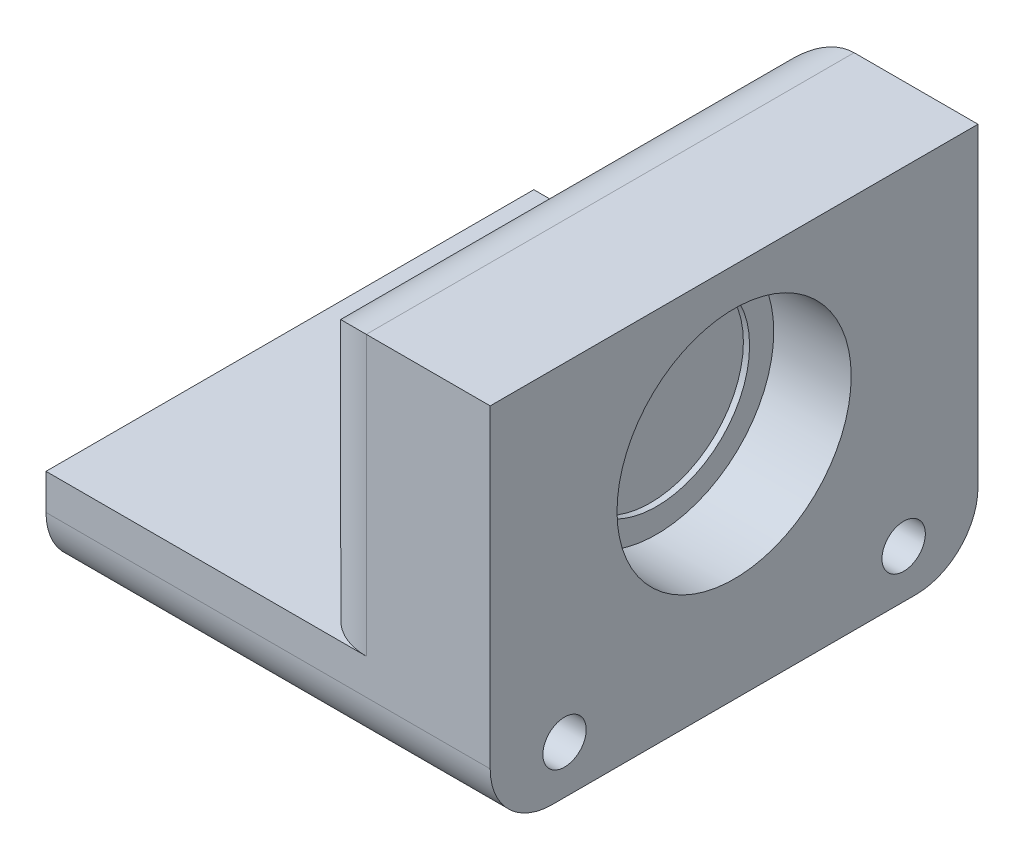
from build123d import *

# Parameters (mm, degrees)
BOSS_EXTRUDE1_DEPTH                            = 20
SKETCH2_R                                      = 1.27
CUT_EXTRUDE1_DEPTH                             = 4.000000128
SKETCH3_R                                      = 4.8006
CUT_EXTRUDE2_DEPTH                             = 3.175
SKETCH4_R                                      = 3.81
CUT_EXTRUDE3_DEPTH                             = 0.254
CUT_EXTRUDE4_START                             = -3.175
SKETCH5_R                                      = 4.8006
CUT_EXTRUDE4_DEPTH                             = 3.175
CUT_EXTRUDE5_START                             = -0.254
SKETCH6_R                                      = 3.81
CUT_EXTRUDE5_DEPTH                             = 0.254
CBORE_FOR_0_SOCKET_HEAD_CAP_SCREW1_D           = 1.778
CBORE_FOR_0_SOCKET_HEAD_CAP_SCREW1_CBORE_D     = 3.175
CBORE_FOR_0_SOCKET_HEAD_CAP_SCREW1_CBORE_DEPTH = 14.732
FILLET1_R                                      = 2.54
SKETCH10_R                                     = 1.2635
CUT_EXTRUDE6_DEPTH                             = 77.059452864


with BuildPart() as part:
    # Sketch1 → Boss-Extrude1 (new body)
    with BuildSketch(Plane.XY):
        Polygon((-71.742285041, 0), (-71.742285041, -4), (-53.530479711, -4), (-53.530479711, 11.43), (-61.150490131, 11.43), (-61.150490131, 0), align=None)
    extrude(amount=-BOSS_EXTRUDE1_DEPTH)

    # Sketch2 → Cut-Extrude1 (cut)
    with BuildSketch(Plane.ZY.offset(71.742285041)):
        with Locations((-12.286, -2)):
            Circle(SKETCH2_R)
        with Locations(Location((-7.714, -2, 0), (0, 0, 180))):
            Circle(SKETCH2_R)
    extrude(amount=-CUT_EXTRUDE1_DEPTH, mode=Mode.SUBTRACT)

    # Sketch3 → Cut-Extrude2 (cut)
    with BuildSketch(Plane.ZY.offset(61.150490131)):
        with Locations((-10, 5.08)):
            Circle(SKETCH3_R)
    extrude(amount=-CUT_EXTRUDE2_DEPTH, mode=Mode.SUBTRACT)

    # Sketch4 → Cut-Extrude3 (cut)
    with BuildSketch(Plane.ZY.offset(57.975490131)):
        with Locations((-10, 5.08)):
            Circle(SKETCH4_R)
    extrude(amount=-CUT_EXTRUDE3_DEPTH, mode=Mode.SUBTRACT)

    # Sketch5 → Cut-Extrude4 (cut)
    with BuildSketch(Plane(origin=(-53.530479711, 0, 0), x_dir=(0, 0, -1), z_dir=(1, 0, 0)).offset(CUT_EXTRUDE4_START)):
        with Locations(Location((10, 5.08, 0), (0, 0, 180))):
            Circle(SKETCH5_R)
    extrude(amount=CUT_EXTRUDE4_DEPTH, mode=Mode.SUBTRACT)

    # Sketch6 → Cut-Extrude5 (cut)
    with BuildSketch(Plane(origin=(-56.705479711, 0, 0), x_dir=(0, 0, -1), z_dir=(1, 0, 0)).offset(CUT_EXTRUDE5_START)):
        with Locations(Location((10, 5.08, 0), (0, 0, 180))):
            Circle(SKETCH6_R)
    extrude(amount=CUT_EXTRUDE5_DEPTH, mode=Mode.SUBTRACT)

    # CBORE for #0 Socket Head Cap Screw1 (through all)
    with Locations(Plane.ZY.offset(71.742285041)):
        with Locations((-16.952, -2.032), (-3.048, -2.032)):
            CounterBoreHole(CBORE_FOR_0_SOCKET_HEAD_CAP_SCREW1_D / 2, CBORE_FOR_0_SOCKET_HEAD_CAP_SCREW1_CBORE_D / 2, CBORE_FOR_0_SOCKET_HEAD_CAP_SCREW1_CBORE_DEPTH)

    # Fillet1
    # the kernel refuses this fillet: 2.54 mm, written as the material it takes off along each edge
    with BuildSketch(Plane(origin=(-78.092285041, -4, -20), x_dir=(0, 1, 0), z_dir=(1, 0, 0))) as fillet1_piece_1:
        with BuildLine():
            CenterArc((FILLET1_R, FILLET1_R), FILLET1_R, 180, 90)
            Line((0, FILLET1_R), (0, 0))
            Line((0, 0), (FILLET1_R, 0))
        make_face()
    extrude(amount=30.91180533, mode=Mode.SUBTRACT)
    with BuildSketch(Plane(origin=(-61.150490131, 11.43, 6.35), x_dir=(0, -1, 0), z_dir=(0, 0, -1))) as fillet1_piece_2:
        with BuildLine():
            CenterArc((FILLET1_R, -FILLET1_R), FILLET1_R, 90, 90)
            Line((0, -FILLET1_R), (0, 0))
            Line((0, 0), (FILLET1_R, 0))
        make_face()
    extrude(amount=32.7, mode=Mode.SUBTRACT)
    with BuildSketch(Plane(origin=(-61.150490131, 17.78, -20), x_dir=(1, 0, 0), z_dir=(0, -1, 0))) as fillet1_piece_3:
        with BuildLine():
            CenterArc((FILLET1_R, FILLET1_R), FILLET1_R, 180, 90)
            Line((0, FILLET1_R), (0, 0))
            Line((0, 0), (FILLET1_R, 0))
        make_face()
    extrude(amount=17.78, mode=Mode.SUBTRACT)
    with BuildSketch(Plane(origin=(-61.150490131, 17.78, 0), x_dir=(1, 0, 0), z_dir=(0, -1, 0))) as fillet1_piece_4:
        with BuildLine():
            CenterArc((FILLET1_R, -FILLET1_R), FILLET1_R, 90, 90)
            Line((0, -FILLET1_R), (0, 0))
            Line((0, 0), (FILLET1_R, 0))
        make_face()
    extrude(amount=17.78, mode=Mode.SUBTRACT)
    with BuildSketch(Plane(origin=(-78.092285041, -4, 0), x_dir=(0, 1, 0), z_dir=(1, 0, 0))) as fillet1_piece_5:
        with BuildLine():
            CenterArc((FILLET1_R, -FILLET1_R), FILLET1_R, 90, 90)
            Line((0, -FILLET1_R), (0, 0))
            Line((0, 0), (FILLET1_R, 0))
        make_face()
    extrude(amount=30.91180533, mode=Mode.SUBTRACT)

    # Sketch10 → Cut-Extrude6 (cut, through all)
    with BuildSketch(Plane.XZ.offset(4)):
        with Locations((-64.492285063, -7.249999912)):
            Circle(SKETCH10_R)
        with Locations(Location((-64.492285063, -12.750000088, 0), (0, 0, 180))):
            Circle(SKETCH10_R)
    extrude(amount=-CUT_EXTRUDE6_DEPTH, mode=Mode.SUBTRACT)


solid = part.part
